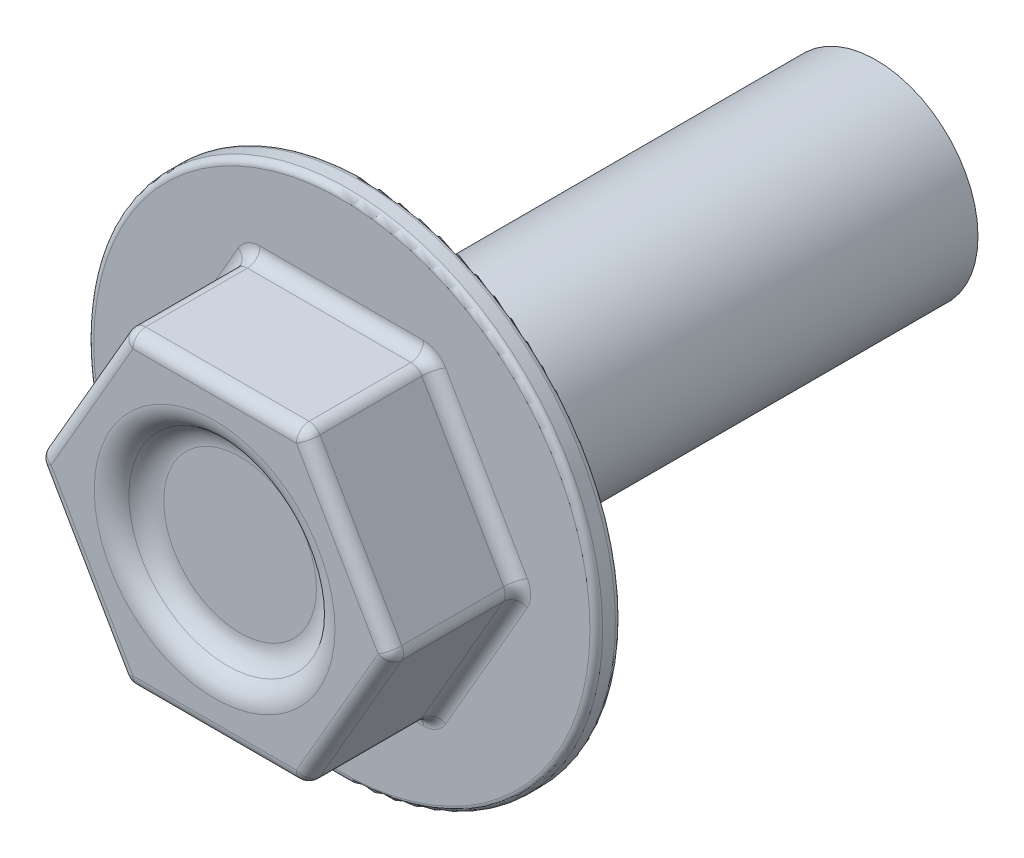
from build123d import *

# Parameters (mm, degrees)
SKETCH1_R           = 8
BOSS_EXTRUDE1_DEPTH = 40
SKETCH1_3_R         = 20
BOSS_EXTRUDE2_DEPTH = 2
BOSS_EXTRUDE3_DEPTH = 10
CUT_EXTRUDE1_START  = 10
SKETCH2_3_R         = 8
CUT_EXTRUDE1_DEPTH  = 2
FILLET1_R           = 0.5
FILLET2_R           = 1
FILLET3_R           = 2
FILLET4_R           = 2


with BuildPart() as part:
    # Sketch1 → Boss-Extrude1 (new body)
    with BuildSketch(Plane(origin=(0, 0, 0), x_dir=(0, 1, 0), z_dir=(0, 0, 1))):
        with Locations(Location((0, 0, 0), (0, 0, 270))):
            Circle(SKETCH1_R)
    extrude(amount=-BOSS_EXTRUDE1_DEPTH)

    # Sketch1<3> → Boss-Extrude2 (add)
    with BuildSketch(Plane(origin=(0, 0, 0), x_dir=(0, 1, 0), z_dir=(0, 0, 1))):
        with Locations(Location((0, 0, 0), (0, 0, 270))):
            Circle(SKETCH1_3_R)
    extrude(amount=BOSS_EXTRUDE2_DEPTH)

    # Sketch2 → Boss-Extrude3 (add)
    with BuildSketch(Plane.XY.offset(2)):
        Polygon((-14, 0), (-7, -12.124355653), (7, -12.124355653), (14, 0), (7, 12.124355653), (-7, 12.124355653), align=None)
    extrude(amount=BOSS_EXTRUDE3_DEPTH)

    # Sketch2<3> → Cut-Extrude1 (cut)
    with BuildSketch(Plane.XY.offset(2).offset(CUT_EXTRUDE1_START)):
        Circle(SKETCH2_3_R)
    extrude(amount=-CUT_EXTRUDE1_DEPTH, mode=Mode.SUBTRACT)

    # Fillet1
    fillet1_edges = [part.edges().sort_by_distance(p)[0] for p in [
        (-20, 0, 0),
        (-20, 0, 2),
    ]]
    fillet(fillet1_edges, radius=FILLET1_R)

    # Fillet2
    fillet2_edges = [part.edges().sort_by_distance(p)[0] for p in [
        (0, -12.124355653, 2),
        (-7, -12.124355653, 7),
        (10.5, -6.062177826, 2),
        (7, -12.124355653, 7),
        (10.5, 6.062177826, 2),
        (14, 0, 7),
        (0, 12.124355653, 2),
        (7, 12.124355653, 7),
        (-10.5, 6.062177826, 2),
        (-7, 12.124355653, 7),
        (-10.5, -6.062177826, 2),
        (-14, 0, 7),
        (0, -12.124355653, 12),
        (10.5, -6.062177826, 12),
        (10.5, 6.062177826, 12),
        (0, 12.124355653, 12),
        (-10.5, 6.062177826, 12),
        (-10.5, -6.062177826, 12),
    ]]
    fillet(fillet2_edges, radius=FILLET2_R)

    # Fillet3
    fillet3_edges = [part.edges().sort_by_distance(p)[0] for p in [
        (-8, 0, 10),
    ]]
    fillet(fillet3_edges, radius=FILLET3_R - 0.0001)  # a hair under: the kernel refuses the full size

    # Fillet4
    fillet4_edges = [part.edges().sort_by_distance(p)[0] for p in [
        (-8, 0, 12),
    ]]
    fillet(fillet4_edges, radius=FILLET4_R)


solid = part.part
